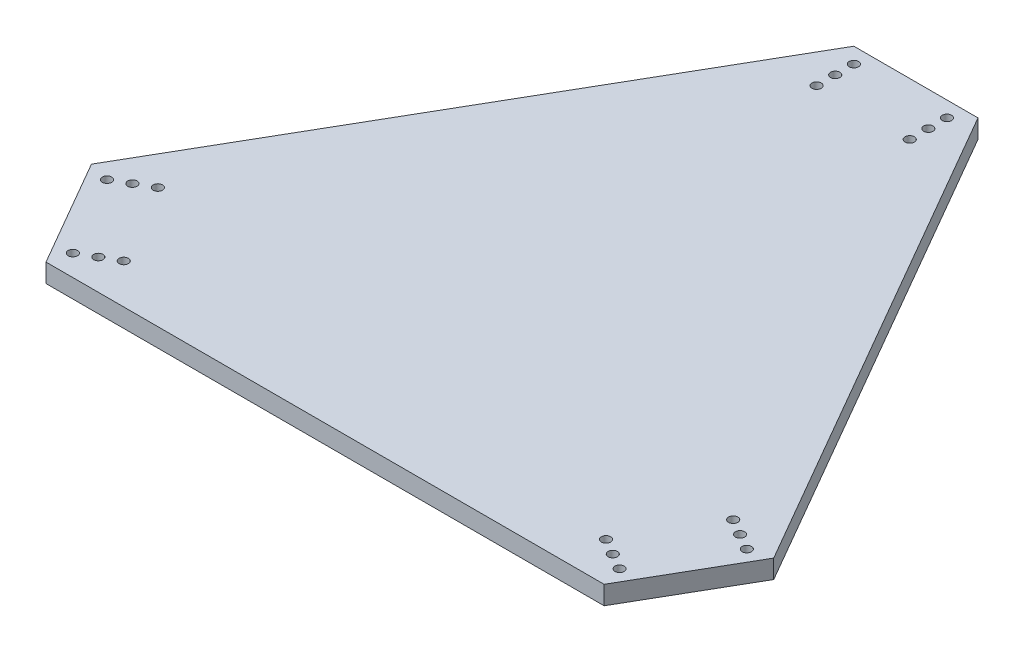
from build123d import *

# Parameters (mm, degrees)
BOSS_EXTRUDE2_DEPTH = 6
SKETCH9_R           = 1.5
CUT_EXTRUDE1_DEPTH  = 160.44448166


with BuildPart() as part:
    # Sketch8 → Boss-Extrude2 (new body)
    with BuildSketch(Plane(origin=(0, 0, 0), x_dir=(1, 0, 0), z_dir=(0, 1, 0))):
        Polygon((-20, 115.358983849), (20, 115.358983849), (109.903810568, -40.358983849), (89.903810568, -75), (-89.903810568, -75), (-109.903810568, -40.358983849), align=None)
    extrude(amount=BOSS_EXTRUDE2_DEPTH)

    # Sketch9 → Cut-Extrude1 (cut, through all)
    with BuildSketch(Plane(origin=(0, 6, 0), x_dir=(1, 0, 0), z_dir=(0, 1, 0))):
        with Locations((15, 110.358983849)):
            Circle(SKETCH9_R)
        with Locations((-15, 110.358983849)):
            Circle(SKETCH9_R)
        with Locations((-15, 104.358983849)):
            Circle(SKETCH9_R)
        with Locations((-15, 98.358983849)):
            Circle(SKETCH9_R)
        with Locations((15, 104.358983849)):
            Circle(SKETCH9_R)
        with Locations((15, 98.358983849)):
            Circle(SKETCH9_R)
        with Locations((88.073683549, -68.169872981)):
            Circle(SKETCH9_R)
        with Locations((103.073683549, -42.189110868)):
            Circle(SKETCH9_R)
        with Locations((97.877531126, -39.189110868)):
            Circle(SKETCH9_R)
        with Locations((92.681378703, -36.189110868)):
            Circle(SKETCH9_R)
        with Locations((82.877531126, -65.169872981)):
            Circle(SKETCH9_R)
        with Locations((77.681378703, -62.169872981)):
            Circle(SKETCH9_R)
        with Locations((-103.073683549, -42.189110868)):
            Circle(SKETCH9_R)
        with Locations((-88.073683549, -68.169872981)):
            Circle(SKETCH9_R)
        with Locations((-82.877531126, -65.169872981)):
            Circle(SKETCH9_R)
        with Locations((-77.681378703, -62.169872981)):
            Circle(SKETCH9_R)
        with Locations((-97.877531126, -39.189110868)):
            Circle(SKETCH9_R)
        with Locations((-92.681378703, -36.189110868)):
            Circle(SKETCH9_R)
    extrude(amount=-CUT_EXTRUDE1_DEPTH, mode=Mode.SUBTRACT)


solid = part.part
